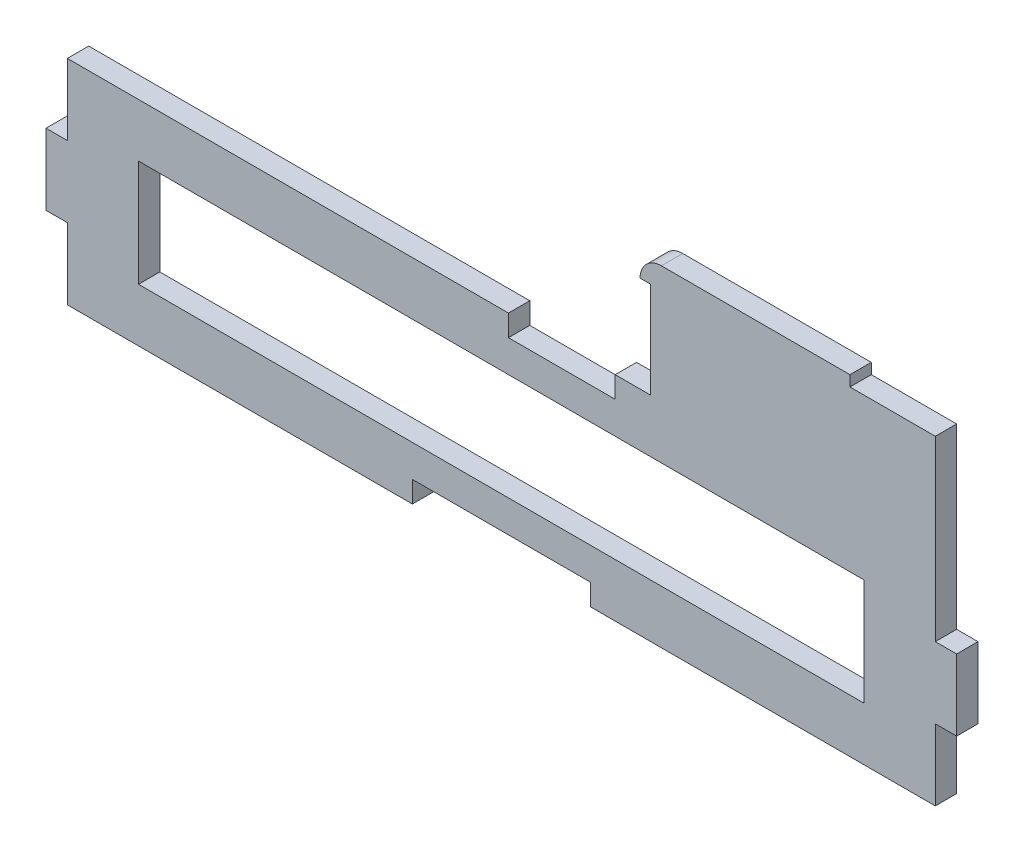
from build123d import *

# Parameters (mm, degrees)
SKETCH_1_W      = 204
SKETCH_1_H      = 30
EXTRUDE_1_DEPTH = 6
FILLET_1_R      = 6


with BuildPart() as part:
    # Эскиз1 → Бобышка-Вытянуть1 (new body)
    with BuildSketch(Plane.XY):
        Polygon((0, 20), (0, 0), (97, 0), (97, 6), (147, 6), (147, 0), (244, 0), (244, 20), (250, 20), (250, 40), (244, 40), (244, 90), (220, 90), (220, 93), (161, 93), (161, 87), (164, 87), (164, 60), (154, 60), (154, 54), (124, 54), (124, 60), (0, 60), (0, 40), (-6, 40), (-6, 20), align=None)
        with Locations((122, 30)):
            Rectangle(SKETCH_1_W, SKETCH_1_H, mode=Mode.SUBTRACT)
    extrude(amount=EXTRUDE_1_DEPTH)

    # Скругление1
    fillet_1_edges = [part.edges().sort_by_distance(p)[0] for p in [
        (161, 93, 3),
    ]]
    fillet(fillet_1_edges, radius=FILLET_1_R - 0.0001)  # a hair under: the kernel refuses the full size


solid = part.part
